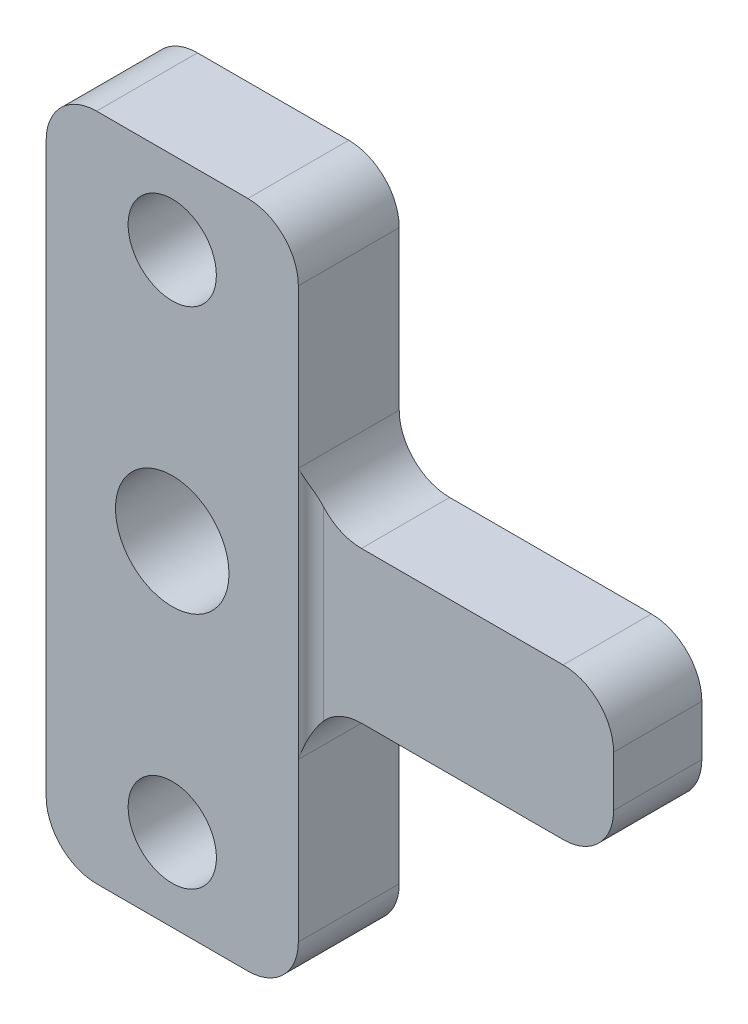
from build123d import *

# Parameters (mm, degrees)
SKETCH1_W           = 10
SKETCH1_H           = 26.532998322
SKETCH1_R           = 2.25
SKETCH1_R_2         = 1.75
BOSS_EXTRUDE1_DEPTH = 4
SKETCH6_W           = 12
SKETCH6_H           = 6
BOSS_EXTRUDE3_DEPTH = 3.5
FILLET1_R           = 2
FILLET2_R           = 2
FILLET3_R           = 0.5
FILLET4_R           = 2


with BuildPart() as part:
    # Sketch1 → Boss-Extrude1 (new body)
    with BuildSketch(Plane.XY):
        with Locations((38, 0)):
            Rectangle(SKETCH1_W, SKETCH1_H)
        with Locations((38, 0)):
            Circle(SKETCH1_R, mode=Mode.SUBTRACT)
        with Locations((38, 10)):
            Circle(SKETCH1_R_2, mode=Mode.SUBTRACT)
        with Locations(Location((38, -10, 0), (0, 0, 180))):
            Circle(SKETCH1_R_2, mode=Mode.SUBTRACT)
    extrude(amount=BOSS_EXTRUDE1_DEPTH)

    # Sketch6 → Boss-Extrude3 (add)
    with BuildSketch(Plane.XY):
        with Locations((49, 0)):
            Rectangle(SKETCH6_W, SKETCH6_H)
    extrude(amount=BOSS_EXTRUDE3_DEPTH)

    # Fillet1
    fillet1_edges = [part.edges().sort_by_distance(p)[0] for p in [
        (55, -3, 1.75),
        (55, 3, 1.75),
    ]]
    fillet(fillet1_edges, radius=FILLET1_R)

    # Fillet2
    fillet2_edges = [part.edges().sort_by_distance(p)[0] for p in [
        (43, 3, 1.75),
        (43, -3, 1.75),
    ]]
    fillet(fillet2_edges, radius=FILLET2_R)

    # Fillet3
    fillet3_edges = [part.edges().sort_by_distance(p)[0] for p in [
        (43, 0, 3.5),
    ]]
    fillet(fillet3_edges, radius=FILLET3_R - 0.0001)  # a hair under: the kernel refuses the full size

    # Fillet4
    fillet4_edges = [part.edges().sort_by_distance(p)[0] for p in [
        (43, -13.266499161, 2),
        (33, -13.266499161, 2),
        (33, 13.266499161, 2),
        (43, 13.266499161, 2),
    ]]
    fillet(fillet4_edges, radius=FILLET4_R)


solid = part.part
